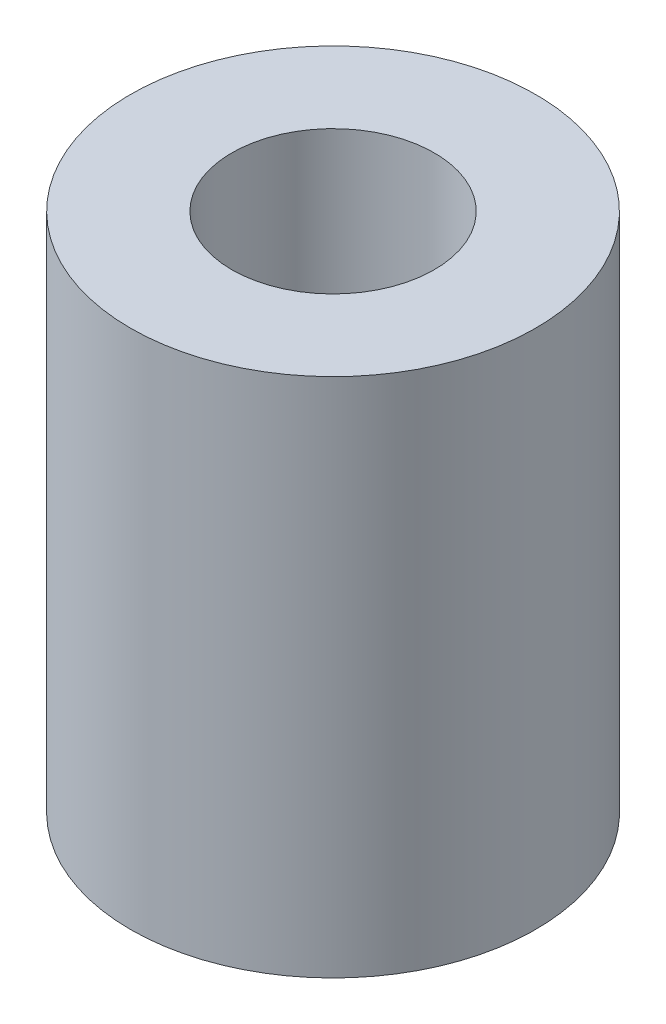
from build123d import *

# Parameters (mm, degrees)
SKETCH_1_R      = 3.5
SKETCH_1_R_2    = 1.75
EXTRUDE_1_DEPTH = 9


with BuildPart() as part:
    # Эскиз1 → Бобышка-Вытянуть1 (new body)
    with BuildSketch(Plane(origin=(0, 0, 0), x_dir=(1, 0, 0), z_dir=(0, 1, 0))):
        Circle(SKETCH_1_R)
        Circle(SKETCH_1_R_2, mode=Mode.SUBTRACT)
    extrude(amount=EXTRUDE_1_DEPTH)


solid = part.part
